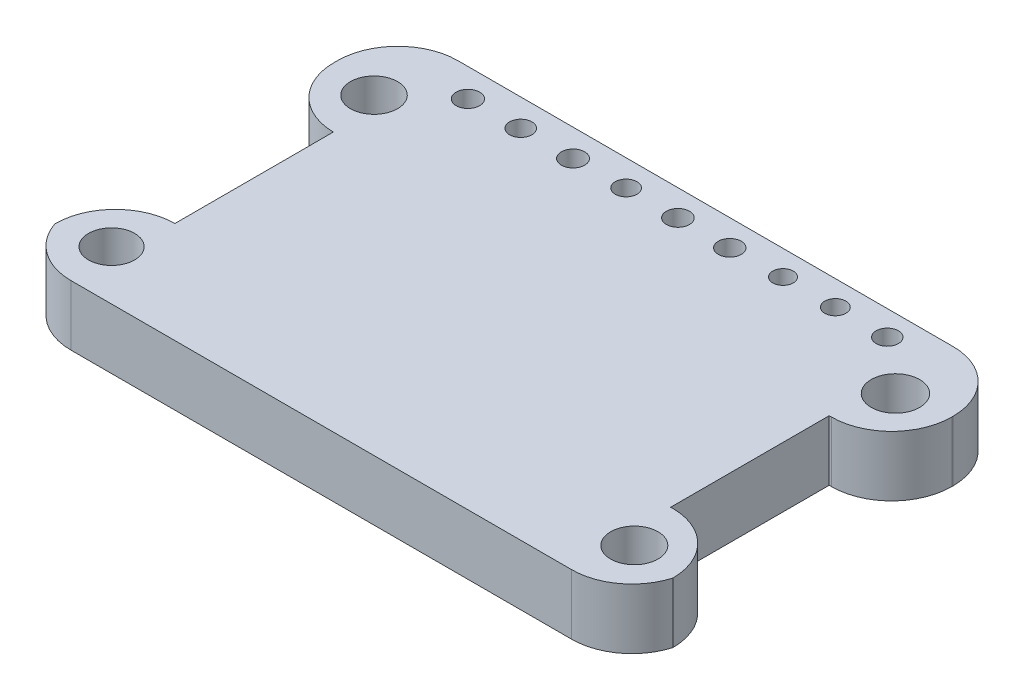
from build123d import *

# Parameters (mm, degrees)
SKETCH1_W           = 30.65
SKETCH1_H           = 19.11
BOSS_EXTRUDE1_DEPTH = 3
SKETCH4_W           = 3.107341839
SKETCH4_H           = 7.887877928
CUT_EXTRUDE1_DEPTH  = 37.243821542
FILLET5_R           = 3
SKETCH5_W           = 2.973903927
SKETCH5_H           = 7.883841559
CUT_EXTRUDE2_DEPTH  = 37.243821542
FILLET6_R           = 3
FILLET7_R           = 3
SKETCH6_R           = 1.147476531
SKETCH6_R_2         = 1.171812298
SKETCH6_R_3         = 1.204786214
SKETCH6_R_4         = 1.179845326
CUT_EXTRUDE3_DEPTH  = 37.243821542
SKETCH7_R           = 0.553427196
SKETCH7_R_2         = 0.52616078
SKETCH7_R_3         = 0.51162232
SKETCH7_R_4         = 0.570497963
SKETCH7_R_5         = 0.574861319
SKETCH7_R_6         = 0.542267602
SKETCH7_R_7         = 0.579469216
SKETCH7_R_8         = 0.558015666
SKETCH7_R_9         = 0.586205708
CUT_EXTRUDE4_DEPTH  = 37.243821542


with BuildPart() as part:
    # Sketch1 → Boss-Extrude1 (new body)
    with BuildSketch(Plane(origin=(0, 0, 0), x_dir=(1, 0, 0), z_dir=(0, 1, 0))):
        with Locations((15.325, 9.555)):
            Rectangle(SKETCH1_W, SKETCH1_H)
    extrude(amount=BOSS_EXTRUDE1_DEPTH)

    # Sketch4 → Cut-Extrude1 (cut, through all)
    with BuildSketch(Plane(origin=(0, 3, 0), x_dir=(1, 0, 0), z_dir=(0, 1, 0))):
        with Locations((29.096329081, 9.099362482)):
            Rectangle(SKETCH4_W, SKETCH4_H)
    extrude(amount=-CUT_EXTRUDE1_DEPTH, mode=Mode.SUBTRACT)

    # Fillet5
    fillet5_edges = [part.edges().sort_by_distance(p)[0] for p in [
        (30.65, 1.5, -13.043301446),
        (30.65, 1.5, -5.155423518),
    ]]
    fillet(fillet5_edges, radius=FILLET5_R)

    # Sketch5 → Cut-Extrude2 (cut, through all)
    with BuildSketch(Plane(origin=(0, 3, 0), x_dir=(1, 0, 0), z_dir=(0, 1, 0))):
        with Locations((1.486951964, 8.991865097)):
            Rectangle(SKETCH5_W, SKETCH5_H)
    extrude(amount=-CUT_EXTRUDE2_DEPTH, mode=Mode.SUBTRACT)

    # Fillet6
    # the kernel refuses this fillet: 3 mm, written as the material it takes off along each edge
    with BuildSketch(Plane(origin=(0, 10.5, -12.933785877), x_dir=(1, 0, 0), z_dir=(0, -1, 0))) as fillet6_piece_1_section:
        with BuildLine():
            CenterArc((FILLET6_R, -FILLET6_R), FILLET6_R, 90, 90)
            Line((0, -FILLET6_R), (0, 0))
            Line((0, 0), (FILLET6_R, 0))
        make_face()
    fillet6_piece_1 = extrude(amount=18, mode=Mode.PRIVATE)
    fillet6_piece_1 = split(fillet6_piece_1, bisect_by=Plane(origin=(2.973903927, 10.5, -12.933785877), z_dir=(-1, 0, 0)), keep=Keep.TOP, mode=Mode.PRIVATE)
    add(fillet6_piece_1, mode=Mode.SUBTRACT)
    with BuildSketch(Plane(origin=(0, 10.5, -5.049944318), x_dir=(0, 0, 1), z_dir=(0, -1, 0))) as fillet6_piece_2_section:
        with BuildLine():
            CenterArc((FILLET6_R, -FILLET6_R), FILLET6_R, 90, 90)
            Line((0, -FILLET6_R), (0, 0))
            Line((0, 0), (FILLET6_R, 0))
        make_face()
    fillet6_piece_2 = extrude(amount=18, mode=Mode.PRIVATE)
    fillet6_piece_2 = split(fillet6_piece_2, bisect_by=Plane(origin=(2.973903927, 10.5, -5.049944318), z_dir=(-1, 0, 0)), keep=Keep.TOP, mode=Mode.PRIVATE)
    add(fillet6_piece_2, mode=Mode.SUBTRACT)

    # Fillet7
    # the kernel refuses this fillet: 3 mm, written as the material it takes off along each edge
    with BuildSketch(Plane(origin=(0, -7.5, -19.11), x_dir=(0, 0, 1), z_dir=(0, 1, 0)), Plane(origin=(30.65, -7.5, -19.11), x_dir=(-1, 0, 0), z_dir=(0, 1, 0))) as fillet7_piece_1:
        with BuildLine():
            CenterArc((FILLET7_R, FILLET7_R), FILLET7_R, 180, 90)
            Line((0, FILLET7_R), (-FILLET7_R * 0.02, FILLET7_R))
            Line((-FILLET7_R * 0.02, FILLET7_R), (-FILLET7_R * 0.02, -FILLET7_R * 0.02))
            Line((-FILLET7_R * 0.02, -FILLET7_R * 0.02), (FILLET7_R, -FILLET7_R * 0.02))
            Line((FILLET7_R, -FILLET7_R * 0.02), (FILLET7_R, 0))
        make_face()
    extrude(amount=18, mode=Mode.SUBTRACT)
    with BuildSketch(Plane(origin=(30.65, -7.196653113, 0), x_dir=(0, 0, -1), z_dir=(0, 1, 0))) as fillet7_piece_2:
        with BuildLine():
            CenterArc((3, 2.878661245), FILLET7_R, 180, 73.64872792)
            Line((0, 2.878661245), (-0.06, 2.878661245))
            Line((-0.06, 2.878661245), (-0.06, 0))
            Line((-0.06, 0), (0, -0.06))
            ThreePointArc((0, -0.06), (1.077711759, -0.06), (2.138531988, -0.057573225))
            Line((2.138531988, -0.057573225), (2.155423518, 0))
        make_face()
    extrude(amount=17.393306227, mode=Mode.SUBTRACT)
    with BuildSketch(Plane(origin=(0, -7.113980163, 0), x_dir=(0, 0, -1), z_dir=(0, 1, 0))) as fillet7_piece_3:
        with BuildLine():
            CenterArc((3, -2.845592065), FILLET7_R, 108.462579453, 71.537420547)
            Line((0, -2.845592065), (-0.06, -2.845592065))
            Line((-0.06, -2.845592065), (-0.06, 0))
            Line((-0.06, 0), (0, 0.06))
            ThreePointArc((0, 0.06), (1.024972159, 0.06), (2.030943204, 0.056911841))
            Line((2.030943204, 0.056911841), (2.049944318, 0))
        make_face()
    extrude(amount=17.227960325, mode=Mode.SUBTRACT)

    # Sketch6 → Cut-Extrude3 (cut, through all)
    with BuildSketch(Plane(origin=(0, 3, 0), x_dir=(1, 0, 0), z_dir=(0, 1, 0))):
        with Locations(Location((2.397675936, 2.472562033, 0), (0, 0, 270))):
            Circle(SKETCH6_R)
        with Locations(Location((2.397675936, 15.534628547, 0), (0, 0, 270))):
            Circle(SKETCH6_R_2)
        with Locations(Location((28.233356839, 15.652120685, 0), (0, 0, 270))):
            Circle(SKETCH6_R_3)
        with Locations(Location((28.283999857, 2.604300321, 0), (0, 0, 270))):
            Circle(SKETCH6_R_4)
    extrude(amount=-CUT_EXTRUDE3_DEPTH, mode=Mode.SUBTRACT)

    # Sketch7 → Cut-Extrude4 (cut, through all)
    with BuildSketch(Plane(origin=(0, 3, 0), x_dir=(1, 0, 0), z_dir=(0, 1, 0))):
        with Locations(Location((25.603735312, 17.875013179, 0), (0, 0, 270))):
            Circle(SKETCH7_R)
        with Locations(Location((23.018273663, 17.875013179, 0), (0, 0, 270))):
            Circle(SKETCH7_R_2)
        with Locations(Location((20.414641054, 17.875013179, 0), (0, 0, 270))):
            Circle(SKETCH7_R_3)
        with Locations(Location((17.832185275, 17.808085307, 0), (0, 0, 270))):
            Circle(SKETCH7_R_4)
        with Locations(Location((15.250588263, 17.808085307, 0), (0, 0, 270))):
            Circle(SKETCH7_R_5)
        with Locations(Location((12.672951441, 17.808085307, 0), (0, 0, 270))):
            Circle(SKETCH7_R_6)
        with Locations(Location((10.081016635, 17.756783748, 0), (0, 0, 270))):
            Circle(SKETCH7_R_7)
        with Locations(Location((7.479204756, 17.756783748, 0), (0, 0, 270))):
            Circle(SKETCH7_R_8)
        with Locations(Location((4.895679995, 17.710489857, 0), (0, 0, 270))):
            Circle(SKETCH7_R_9)
    extrude(amount=-CUT_EXTRUDE4_DEPTH, mode=Mode.SUBTRACT)


solid = part.part
